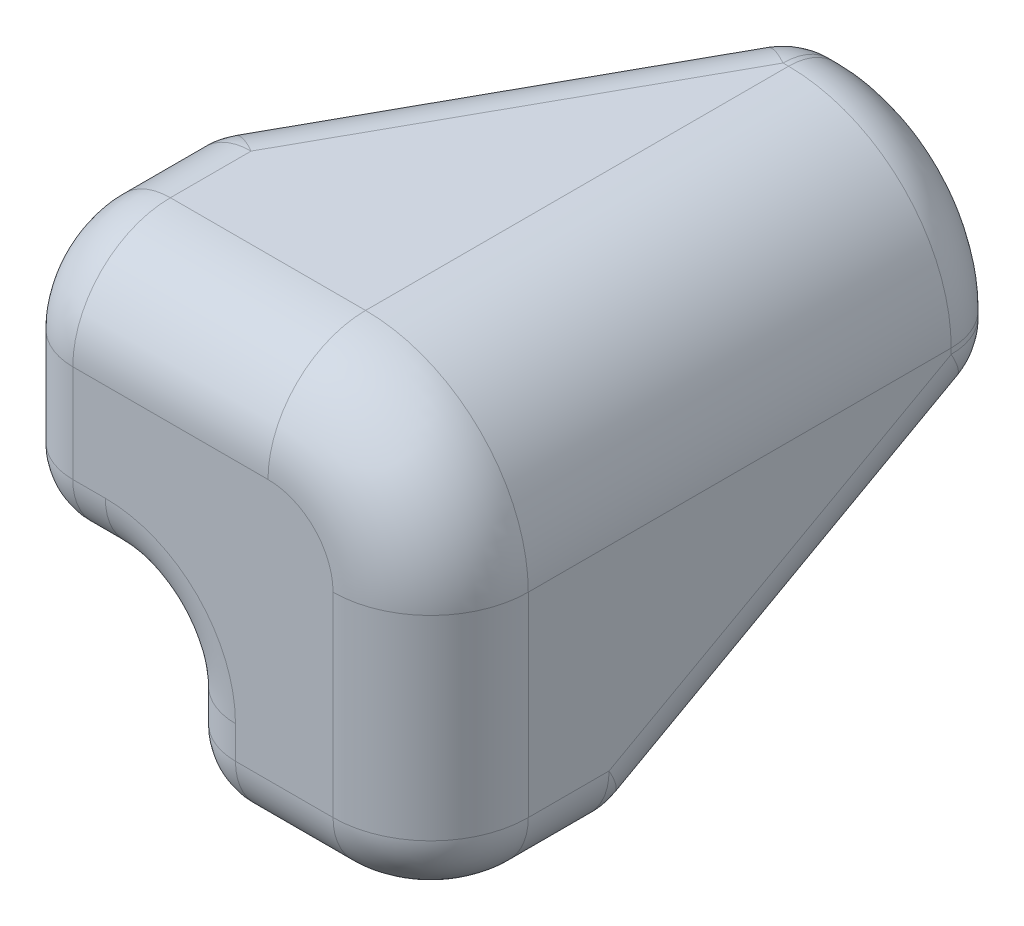
from build123d import *

# Parameters (mm, degrees)
BOSS_EXTRUDE1_DEPTH = 3
SKETCH2_W           = 10
SKETCH2_H           = 3
BOSS_EXTRUDE2_DEPTH = 3
SKETCH3_W           = 3
SKETCH3_H           = 13
BOSS_EXTRUDE3_DEPTH = 3
BOSS_EXTRUDE4_DEPTH = 15
FILLET1_R           = 3
FILLET2_R           = 2
CHAMFER1_SIZE       = 12
CHAMFER1_SIZE2      = 6.651708617
FILLET3_R           = 2
CHAMFER2_SIZE       = 12
CHAMFER2_SIZE2      = 6.651708617
FILLET4_R           = 2
FILLET5_R           = 5
FILLET7_R           = 2
BOSS_EXTRUDE5_DEPTH = 2


with BuildPart() as part:
    # Sketch1 → Boss-Extrude1 (new body)
    with BuildSketch(Plane.XY):
        Polygon((-10, 5), (-5, 5), (-5, 0), (0, 0), (0, 10), (-10, 10), align=None)
    extrude(amount=BOSS_EXTRUDE1_DEPTH)

    # Sketch2 → Boss-Extrude2 (add)
    with BuildSketch(Plane(origin=(0, 10, 0), x_dir=(1, 0, 0), z_dir=(0, 1, 0))):
        with Locations((-5, -1.5)):
            Rectangle(SKETCH2_W, SKETCH2_H)
    extrude(amount=BOSS_EXTRUDE2_DEPTH)

    # Sketch3 → Boss-Extrude3 (add)
    with BuildSketch(Plane(origin=(0, 0, 0), x_dir=(0, 0, -1), z_dir=(1, 0, 0))):
        with Locations((-1.5, 6.5)):
            Rectangle(SKETCH3_W, SKETCH3_H)
    extrude(amount=BOSS_EXTRUDE3_DEPTH)

    # Sketch4 → Boss-Extrude4 (add)
    with BuildSketch(Plane(origin=(0, 0, 0), x_dir=(-1, 0, 0), z_dir=(0, 0, -1))):
        Polygon((10, 13), (-3, 13), (-3, 9.459168036), (-3, 0), (0, 0), (0, 10), (10, 10), align=None)
    extrude(amount=BOSS_EXTRUDE4_DEPTH)

    # Fillet1
    fillet1_edges = [part.edges().sort_by_distance(p)[0] for p in [
        (-3.5, 13, 3),
        (3, 6.5, 3),
    ]]
    fillet(fillet1_edges, radius=FILLET1_R)

    # Fillet2
    fillet2_edges = [part.edges().sort_by_distance(p)[0] for p in [
        (-5, 5, 1.5),
        (-10, 5, 1.5),
        (-5, 0, 1.5),
    ]]
    fillet(fillet2_edges, radius=FILLET2_R)

    # Chamfer1
    chamfer1_edges = [part.edges().sort_by_distance(p)[0] for p in [
        (-10, 11.5, -15),
    ]]
    chamfer1_side = [part.faces().sort_by_distance(p)[0] for p in [
        (-10, 11.031627007, -5.158135036),
    ]]
    chamfer(chamfer1_edges, length=CHAMFER1_SIZE, length2=CHAMFER1_SIZE2, reference=chamfer1_side[0])

    # Fillet3
    fillet3_edges = [part.edges().sort_by_distance(p)[0] for p in [
        (-3.348291383, 11.5, -15),
        (-10, 11.5, -3),
    ]]
    fillet(fillet3_edges, radius=FILLET3_R)

    # Chamfer2
    chamfer2_edges = [part.edges().sort_by_distance(p)[0] for p in [
        (1.5, 0, -15),
    ]]
    chamfer2_side = [part.faces().sort_by_distance(p)[0] for p in [
        (1.031627007, 0, -5.158135036),
    ]]
    chamfer(chamfer2_edges, length=CHAMFER2_SIZE, length2=CHAMFER2_SIZE2, reference=chamfer2_side[0])

    # Fillet4
    fillet4_edges = [part.edges().sort_by_distance(p)[0] for p in [
        (1.5, 6.651708617, -15),
        (1.5, 0, -3),
    ]]
    fillet(fillet4_edges, radius=FILLET4_R)

    # Fillet5
    # the kernel refuses this fillet: 5 mm, written as the material it takes off along each edge
    with BuildSketch(Plane(origin=(-2, 8, 3), x_dir=(1, 0, 0), z_dir=(0, -1, 0))) as fillet5_piece_1:
        with BuildLine():
            CenterArc((2, -3), 3, 0, 90)
            Line((5, -3), (5, 0))
            Line((5, 0), (2, 0))
        make_face()
    revolve(axis=Axis((-2, 8, 3), (0, 0, 1)), revolution_arc=90, mode=Mode.SUBTRACT)
    with BuildSketch(Plane(origin=(3, 13, 3), x_dir=(0, -1, 0), z_dir=(0, 0, -1))) as fillet5_piece_2:
        with BuildLine():
            CenterArc((FILLET5_R, FILLET5_R), FILLET5_R, 180, 90)
            Line((0, FILLET5_R), (0, 0))
            Line((0, 0), (FILLET5_R, 0))
        make_face()
    extrude(amount=30.5, mode=Mode.SUBTRACT)

    # Fillet7
    fillet7_edges = [part.edges().sort_by_distance(p)[0] for p in [
        (-2.085100675, 13, -15),
        (-6.834340089, 13, -8.711001656),
        (-10, 13, -1.241382416),
        (-9.936295281, 13, -2.983524839),
        (-3.185278076, 13, -14.723258321),
        (3, 3.165659911, -8.711001656),
        (3, 0.063704719, -2.983524839),
        (3, 6.814721924, -14.723258321),
        (3, 7.914899325, -15),
        (1.535533906, 11.535533906, -15),
        (3, 0, -1.241382416),
        (2.121320344, 0, 2.121320344),
        (-10, 8.5, 3),
        (-10, 12.121320344, 2.121320344),
        (-5, 2.5, 3),
        (-7.5, 5, 3),
        (-1.5, 0, 3),
        (-4.414213562, 0.585786438, 3),
        (-9.414213562, 5.585786438, 3),
        (-5.585786438, 4.414213562, 3),
    ]]
    fillet(fillet7_edges, radius=FILLET7_R)

    # Sketch5 → Boss-Extrude5 (add)
    with BuildSketch(Plane(origin=(0, 0, 0), x_dir=(-1, 0, 0), z_dir=(0, 0, -1))):
        with BuildLine():
            Line((10, 8), (10, 7))
            ThreePointArc((10, 7), (9.414213562, 5.585786438), (8, 5))
            Line((8, 5), (7, 5))
            ThreePointArc((7, 5), (5.585786438, 4.414213562), (5, 3))
            Line((5, 3), (5, 2))
            ThreePointArc((5, 2), (4.414213562, 0.585786438), (3, 0))
            Line((3, 0), (2, 0))
            Line((2, 0), (2, 8))
            Line((2, 8), (10, 8))
        make_face()
    extrude(amount=BOSS_EXTRUDE5_DEPTH)


solid = part.part
